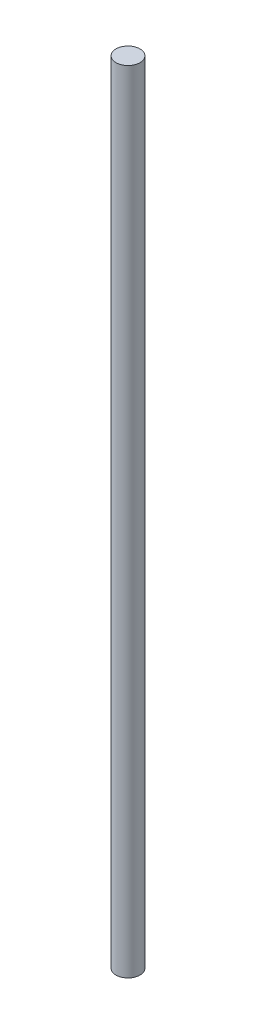
from build123d import *

# Parameters (mm, degrees)
SKETCH1_R           = 5
BOSS_EXTRUDE1_DEPTH = 330.2


with BuildPart() as part:
    # Sketch1 → Boss-Extrude1 (new body)
    with BuildSketch(Plane(origin=(0, 0, 0), x_dir=(1, 0, 0), z_dir=(0, 1, 0))):
        Circle(SKETCH1_R)
    extrude(amount=BOSS_EXTRUDE1_DEPTH)


solid = part.part
